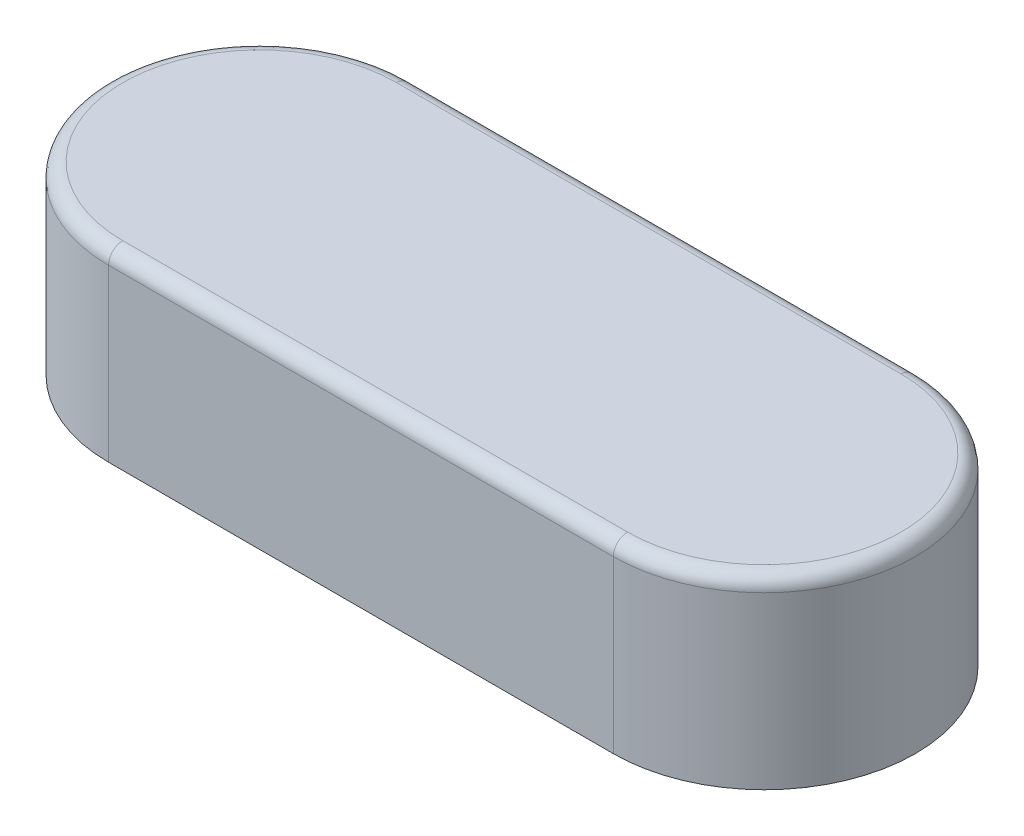
from build123d import *

# Parameters (mm, degrees)
BOSS_EXTRUDE1_DEPTH      = 37
BOSS_EXTRUDE1_DEPTH_BACK = 15
CUT_EXTRUDE1_DEPTH       = 10
CUT_EXTRUDE1_DEPTH_BACK  = 20
SKETCH2_R                = 2.1
FILLET1_R                = 4
SHELL2_START             = -15
SHELL2_DEPTH             = 47.999999899
SHELL2_START_2           = 13
SHELL2_2_DEPTH           = 19.999999899
SHELL2_START_3           = -142
SHELL2_3_DEPTH           = 142
SHELL2_4_ANGLE           = 180
SHELL2_5_ANGLE           = 180


with BuildPart() as part:
    # Sketch1 → Boss-Extrude1 (new, two sides: drawn at the far end of the back side and taken through both)
    with BuildSketch(Plane(origin=(0, 0, 0), x_dir=(1, 0, 0), z_dir=(0, 1, 0)).offset(-BOSS_EXTRUDE1_DEPTH_BACK)):
        with BuildLine():
            Line((0, 42.5), (-142, 42.5))
            ThreePointArc((-142, 42.5), (-184.5, 0), (-142, -42.5))
            Line((-142, -42.5), (0, -42.5))
            ThreePointArc((0, -42.5), (42.5, 0), (0, 42.5))
        make_face()
    extrude(amount=BOSS_EXTRUDE1_DEPTH + BOSS_EXTRUDE1_DEPTH_BACK)

    # Sketch2 → Cut-Extrude1 (cut, two sides: drawn at the far end of the back side and taken through both)
    with BuildSketch(Plane(origin=(0, 0, 0), x_dir=(1, 0, 0), z_dir=(0, 1, 0)).offset(-CUT_EXTRUDE1_DEPTH_BACK)):
        with Locations(Location((-142, 37.5, 0), (0, 0, 270))):
            Circle(SKETCH2_R)
        with Locations(Location((-179.5, 0, 0), (0, 0, 270))):
            Circle(SKETCH2_R)
        with Locations(Location((-142, -37.5, 0), (0, 0, 270))):
            Circle(SKETCH2_R)
        with Locations(Location((0, -37.5, 0), (0, 0, 270))):
            Circle(SKETCH2_R)
        with Locations(Location((37.5, 0, 0), (0, 0, 270))):
            Circle(SKETCH2_R)
        with Locations(Location((0, 37.5, 0), (0, 0, 270))):
            Circle(SKETCH2_R)
    extrude(amount=CUT_EXTRUDE1_DEPTH + CUT_EXTRUDE1_DEPTH_BACK, mode=Mode.SUBTRACT)

    # Fillet1
    fillet1_edges = [part.edges().sort_by_distance(p)[0] for p in [
        (-71, 37, 42.5),
        (42.5, 37, 0),
        (-71, 37, -42.5),
        (-184.5, 37, 0),
    ]]
    fillet(fillet1_edges, radius=FILLET1_R)

    # Shell2: read off the stored shape, not the designer's step
    # Shell2 outline → Shell2 (cut)
    with BuildSketch(Plane(origin=(0, 0, 0), x_dir=(1, 0, 0), z_dir=(0, 1, 0)).offset(SHELL2_START)):
        with BuildLine():
            ThreePointArc((4.806011234, 39.206533333), (-0.157511676, 32.402432926), (-4.691481642, 39.5))
            Line((-4.691481642, 39.5), (-137.308518358, 39.5))
            ThreePointArc((-137.308518358, 39.5), (-141.842488324, 32.402432926), (-146.806011234, 39.206533333))
            ThreePointArc((-146.806011234, 39.206533333), (-169.930717857, 27.930717857), (-181.206533333, 4.806011234))
            ThreePointArc((-181.206533333, 4.806011234), (-174.4, 0), (-181.206533333, -4.806011234))
            ThreePointArc((-181.206533333, -4.806011234), (-169.930717857, -27.930717857), (-146.806011234, -39.206533333))
            ThreePointArc((-146.806011234, -39.206533333), (-141.842488324, -32.402432926), (-137.308518358, -39.5))
            Line((-137.308518358, -39.5), (-4.691481642, -39.5))
            ThreePointArc((-4.691481642, -39.5), (-0.157511676, -32.402432926), (4.806011234, -39.206533333))
            ThreePointArc((4.806011234, -39.206533333), (27.930717857, -27.930717857), (39.206533333, -4.806011234))
            ThreePointArc((39.206533333, -4.806011234), (32.4, 0), (39.206533333, 4.806011234))
            ThreePointArc((39.206533333, 4.806011234), (27.930717857, 27.930717857), (4.806011234, 39.206533333))
        make_face()
    extrude(amount=SHELL2_DEPTH, mode=Mode.SUBTRACT)

    # Shell2 2 outline → Shell2 2 (cut)
    with BuildSketch(Plane(origin=(0, 0, 0), x_dir=(1, 0, 0), z_dir=(0, 1, 0)).offset(SHELL2_START_2)):
        with BuildLine():
            ThreePointArc((4.806011234, 39.206533333), (2.407481395, 39.426565071), (0, 39.5))
            Line((0, 39.5), (-4.691481642, 39.5))
            ThreePointArc((-4.691481642, 39.5), (-0.157511676, 32.402432926), (4.806011234, 39.206533333))
        make_face()
        with BuildLine():
            ThreePointArc((-146.806011234, 39.206533333), (-141.842488324, 32.402432926), (-137.308518358, 39.5))
            Line((-137.308518358, 39.5), (-142, 39.5))
            ThreePointArc((-142, 39.5), (-144.407481395, 39.426565071), (-146.806011234, 39.206533333))
        make_face()
        with BuildLine():
            ThreePointArc((39.206533333, -4.806011234), (39.5, 0), (39.206533333, 4.806011234))
            ThreePointArc((39.206533333, 4.806011234), (32.4, 0), (39.206533333, -4.806011234))
        make_face()
        with BuildLine():
            ThreePointArc((-181.206533333, -4.806011234), (-174.4, 0), (-181.206533333, 4.806011234))
            ThreePointArc((-181.206533333, 4.806011234), (-181.5, 0), (-181.206533333, -4.806011234))
        make_face()
        with BuildLine():
            ThreePointArc((0, -39.5), (2.407481395, -39.426565071), (4.806011234, -39.206533333))
            ThreePointArc((4.806011234, -39.206533333), (-0.157511676, -32.402432926), (-4.691481642, -39.5))
            Line((-4.691481642, -39.5), (0, -39.5))
        make_face()
        with BuildLine():
            ThreePointArc((-137.308518358, -39.5), (-141.842488324, -32.402432926), (-146.806011234, -39.206533333))
            ThreePointArc((-146.806011234, -39.206533333), (-144.407481395, -39.426565071), (-142, -39.5))
            Line((-142, -39.5), (-137.308518358, -39.5))
        make_face()
    extrude(amount=SHELL2_2_DEPTH, mode=Mode.SUBTRACT)

    # Shell2 3 outline → Shell2 3 (cut)
    with BuildSketch(Plane.YZ.offset(SHELL2_START_3)):
        with BuildLine():
            ThreePointArc((33, -39.5), (33.707106781, -39.207106781), (34, -38.5))
            Line((34, -38.5), (34, 38.5))
            ThreePointArc((34, 38.5), (33.707106781, 39.207106781), (33, 39.5))
            Line((33, 39.5), (33, -39.5))
        make_face()
    extrude(amount=SHELL2_3_DEPTH, mode=Mode.SUBTRACT)

    # Shell2 4 outline → Shell2 4 (revolve, cut)
    with BuildSketch(Plane(origin=(-142, 0, 0), x_dir=(0, 0, -1), z_dir=(1, 0, 0))):
        with BuildLine():
            ThreePointArc((39.5, 33), (39.207106781, 33.707106781), (38.5, 34))
            Line((38.5, 34), (0, 34))
            Line((0, 34), (0, 33))
            Line((0, 33), (39.5, 33))
        make_face()
    revolve(axis=Axis((-142, 0, 0), (0, 1, 0)), revolution_arc=SHELL2_4_ANGLE, mode=Mode.SUBTRACT)

    # Shell2 5 outline → Shell2 5 (revolve, cut)
    with BuildSketch(Plane.ZY):
        with BuildLine():
            ThreePointArc((39.5, 33), (39.207106781, 33.707106781), (38.5, 34))
            Line((38.5, 34), (0, 34))
            Line((0, 34), (0, 33))
            Line((0, 33), (39.5, 33))
        make_face()
    revolve(axis=Axis((0, 0, 0), (0, 1, 0)), revolution_arc=SHELL2_5_ANGLE, mode=Mode.SUBTRACT)


solid = part.part
